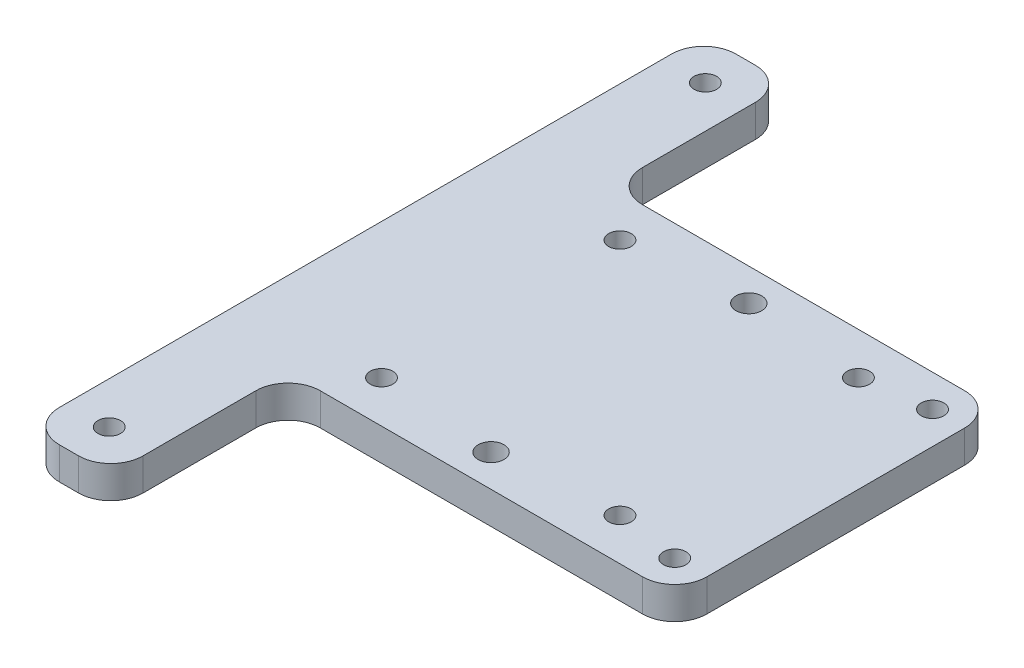
from build123d import *

# Parameters (mm, degrees)
EXTRUDE_1_DEPTH     = 5
FILLET_1_R          = 5
SKETCH_7_R          = 1.75
CUT_EXTRUDE_5_DEPTH = 91.056926441
SKETCH_8_R          = 1.75
CUT_EXTRUDE_6_DEPTH = 91.056926441
SKETCH_9_R          = 1.75
SKETCH_9_R_2        = 2
CUT_EXTRUDE_7_DEPTH = 91.056926441


with BuildPart() as part:
    # 스케치2 → 보스-돌출1 (new body)
    with BuildSketch(Plane(origin=(0, 0, 0), x_dir=(1, 0, 0), z_dir=(0, 1, 0))):
        Polygon((-60, -25), (-60, -52.5), (-73, -52.5), (-73, 52.5), (-60, 52.5), (-60, 25), (0, 25), (0, -25), align=None)
    extrude(amount=EXTRUDE_1_DEPTH)

    # 필렛1
    fillet_1_edges = [part.edges().sort_by_distance(p)[0] for p in [
        (-60, 2.5, -25),
        (0, 2.5, -25),
        (0, 2.5, 25),
        (-60, 2.5, 25),
        (-60, 2.5, 52.5),
        (-73, 2.5, 52.5),
        (-60, 2.5, -52.5),
        (-73, 2.5, -52.5),
    ]]
    fillet(fillet_1_edges, radius=FILLET_1_R)

    # 스케치7 → 컷-돌출5 (cut, through all)
    with BuildSketch(Plane.XZ):
        with Locations((-66.5, -46.25)):
            Circle(SKETCH_7_R)
        with Locations((-66.5, 46.25)):
            Circle(SKETCH_7_R)
    extrude(amount=-CUT_EXTRUDE_5_DEPTH, mode=Mode.SUBTRACT)

    # 스케치8 → 컷-돌출6 (cut, through all)
    with BuildSketch(Plane(origin=(0, 5, 0), x_dir=(1, 0, 0), z_dir=(0, 1, 0))):
        with Locations((-5, 20)):
            Circle(SKETCH_8_R)
        with Locations((-5, -20)):
            Circle(SKETCH_8_R)
    extrude(amount=-CUT_EXTRUDE_6_DEPTH, mode=Mode.SUBTRACT)

    # 스케치9 → 컷-돌출7 (cut, through all)
    with BuildSketch(Plane(origin=(0, 5, 0), x_dir=(1, 0, 0), z_dir=(0, 1, 0))):
        with Locations((-52, 18.5)):
            Circle(SKETCH_9_R)
        with Locations((-52, -18.5)):
            Circle(SKETCH_9_R)
        with Locations((-15, -18.5)):
            Circle(SKETCH_9_R)
        with Locations((-15, 18.5)):
            Circle(SKETCH_9_R)
        with Locations((-33.5, 20)):
            Circle(SKETCH_9_R_2)
        with Locations((-33.5, -20)):
            Circle(SKETCH_9_R_2)
    extrude(amount=-CUT_EXTRUDE_7_DEPTH, mode=Mode.SUBTRACT)


solid = part.part
